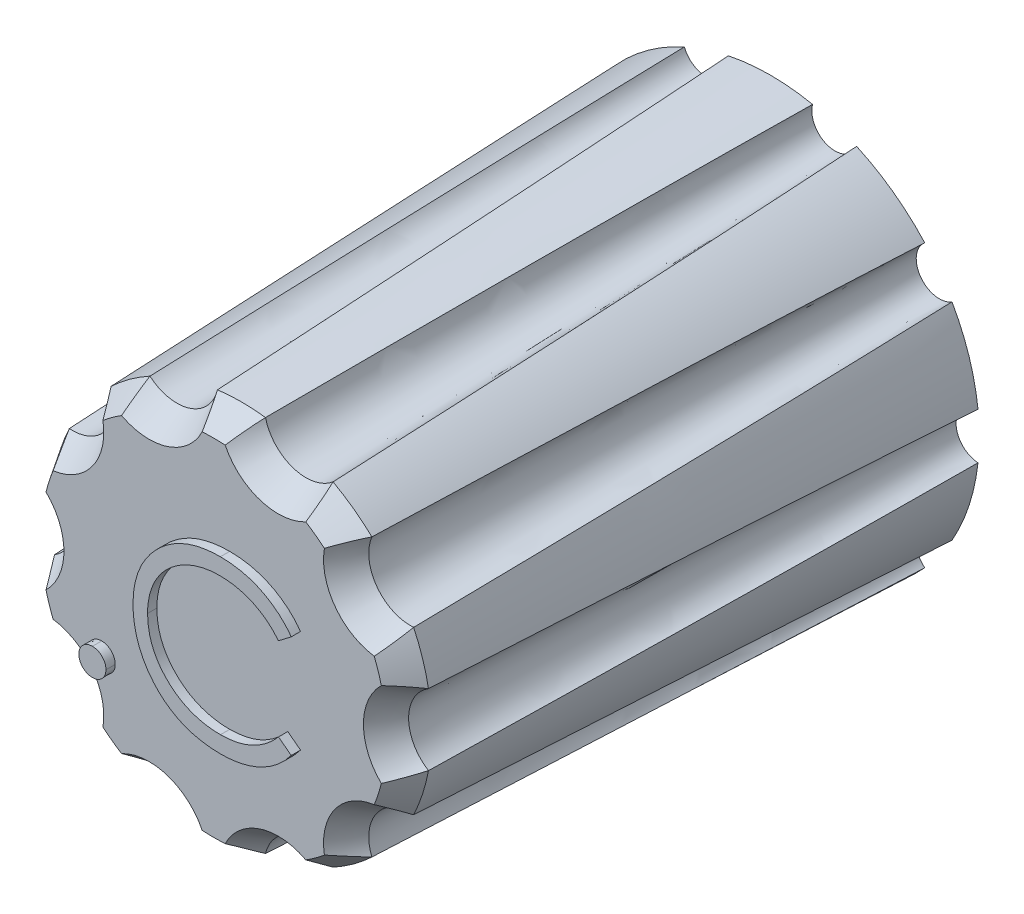
from build123d import *
from OCP.BRepFilletAPI import BRepFilletAPI_MakeChamfer

# Parameters (mm, degrees)
BOSS_EXTRU_1_DEPTH      = 12
BOSS_EXTRU_1_TAPER      = 2
CHANFREIN2_SIZE         = 0.6
CHANFREIN2_SIZE2        = 0.353753521
ENL_V_MAT_EXTRU_1_DEPTH = 10
ESQUISSE4_R             = 0.2
ENL_V_MAT_EXTRU_4_DEPTH = 10
ENL_V_MAT_EXTRU_5_DEPTH = 0.2
BOSS_EXTRU_2_DEPTH      = 0.2
BOSS_EXTRU_2_2_DEPTH    = 0.2
CHANFREIN3_SIZE         = 0.2


with BuildPart() as part:
    # Esquisse1 → Boss.-Extru.1 (new body)
    with BuildSketch(Plane.XY):
        with BuildLine():
            ThreePointArc((4.472222222, -0.499227799), (4, 0), (4.472222222, 0.499227799))
            ThreePointArc((4.472222222, 0.499227799), (4.279754323, 1.390576475), (3.911542518, 2.224822494))
            ThreePointArc((3.911542518, 2.224822494), (3.236067977, 2.351141009), (3.324665043, 3.03259004))
            ThreePointArc((3.324665043, 3.03259004), (2.645033635, 3.640576475), (1.85678652, 4.099066213))
            ThreePointArc((1.85678652, 4.099066213), (1.236067977, 3.804226065), (0.907198818, 4.407605961))
            ThreePointArc((0.907198818, 4.407605961), (0, 4.5), (-0.907198818, 4.407605961))
            ThreePointArc((-0.907198818, 4.407605961), (-1.236067977, 3.804226065), (-1.85678652, 4.099066213))
            ThreePointArc((-1.85678652, 4.099066213), (-2.645033635, 3.640576475), (-3.324665043, 3.03259004))
            ThreePointArc((-3.324665043, 3.03259004), (-3.236067977, 2.351141009), (-3.911542518, 2.224822494))
            ThreePointArc((-3.911542518, 2.224822494), (-4.279754323, 1.390576475), (-4.472222222, 0.499227799))
            ThreePointArc((-4.472222222, 0.499227799), (-4, 0), (-4.472222222, -0.499227799))
            ThreePointArc((-4.472222222, -0.499227799), (-4.279754323, -1.390576475), (-3.911542518, -2.224822494))
            ThreePointArc((-3.911542518, -2.224822494), (-3.236067977, -2.351141009), (-3.324665043, -3.03259004))
            ThreePointArc((-3.324665043, -3.03259004), (-2.645033635, -3.640576475), (-1.85678652, -4.099066213))
            ThreePointArc((-1.85678652, -4.099066213), (-1.236067977, -3.804226065), (-0.907198818, -4.407605961))
            ThreePointArc((-0.907198818, -4.407605961), (0, -4.5), (0.907198818, -4.407605961))
            ThreePointArc((0.907198818, -4.407605961), (1.236067977, -3.804226065), (1.85678652, -4.099066213))
            ThreePointArc((1.85678652, -4.099066213), (2.645033635, -3.640576475), (3.324665043, -3.03259004))
            ThreePointArc((3.324665043, -3.03259004), (3.236067977, -2.351141009), (3.911542518, -2.224822494))
            ThreePointArc((3.911542518, -2.224822494), (4.279754323, -1.390576475), (4.472222222, -0.499227799))
        make_face()
    extrude(amount=BOSS_EXTRU_1_DEPTH, taper=BOSS_EXTRU_1_TAPER)

    # Chanfrein2: one chamfer whose edges measure the first distance from different faces: ONE call of the kernel's chamfer builder (chamfer() names one face for all edges)
    chanfrein2_edges_1 = [part.edges().sort_by_distance(p)[0] for p in [
        (-3.881214819, 1.26108314, 12),
    ]]
    chanfrein2_side_1 = [part.faces().sort_by_distance(p)[0] for p in [
        (-4.080484571, 1.325829807, 6),
    ]]
    chanfrein2_edges_2 = [part.edges().sort_by_distance(p)[0] for p in [
        (-2.897050026, 2.104830049, 12),
    ]]
    chanfrein2_side_2 = [part.faces().sort_by_distance(p)[0] for p in [
        (-3.066559002, 2.227985529, 6),
    ]]
    chanfrein2_edges_3 = [part.edges().sort_by_distance(p)[0] for p in [
        (-2.398722676, 3.301558523, 12),
    ]]
    chanfrein2_side_3 = [part.faces().sort_by_distance(p)[0] for p in [
        (-2.521878155, 3.471067499, 6),
    ]]
    chanfrein2_edges_4 = [part.edges().sort_by_distance(p)[0] for p in [
        (-1.106574643, 3.405686561, 12),
    ]]
    chanfrein2_side_4 = [part.faces().sort_by_distance(p)[0] for p in [
        (-1.17132131, 3.604956313, 6),
    ]]
    chanfrein2_edges_5 = [part.edges().sort_by_distance(p)[0] for p in [
        (0, 4.080950766, 12),
    ]]
    chanfrein2_side_5 = [part.faces().sort_by_distance(p)[0] for p in [
        (0, 4.290475383, 6),
    ]]
    chanfrein2_edges_6 = [part.edges().sort_by_distance(p)[0] for p in [
        (1.106574643, 3.405686561, 12),
    ]]
    chanfrein2_side_6 = [part.faces().sort_by_distance(p)[0] for p in [
        (1.17132131, 3.604956313, 6),
    ]]
    chanfrein2_edges_7 = [part.edges().sort_by_distance(p)[0] for p in [
        (2.398722676, 3.301558523, 12),
    ]]
    chanfrein2_side_7 = [part.faces().sort_by_distance(p)[0] for p in [
        (2.521878155, 3.471067499, 6),
    ]]
    chanfrein2_edges_8 = [part.edges().sort_by_distance(p)[0] for p in [
        (2.897050026, 2.104830049, 12),
    ]]
    chanfrein2_side_8 = [part.faces().sort_by_distance(p)[0] for p in [
        (3.066559002, 2.227985529, 6),
    ]]
    chanfrein2_edges_9 = [part.edges().sort_by_distance(p)[0] for p in [
        (3.881214819, 1.26108314, 12),
    ]]
    chanfrein2_side_9 = [part.faces().sort_by_distance(p)[0] for p in [
        (4.080484571, 1.325829807, 6),
    ]]
    chanfrein2_edges_10 = [part.edges().sort_by_distance(p)[0] for p in [
        (3.580950766, 0, 12),
    ]]
    chanfrein2_side_10 = [part.faces().sort_by_distance(p)[0] for p in [
        (3.790475383, 0, 6),
    ]]
    chanfrein2_edges_11 = [part.edges().sort_by_distance(p)[0] for p in [
        (3.881214819, -1.26108314, 12),
    ]]
    chanfrein2_side_11 = [part.faces().sort_by_distance(p)[0] for p in [
        (4.080484571, -1.325829807, 6),
    ]]
    chanfrein2_edges_12 = [part.edges().sort_by_distance(p)[0] for p in [
        (2.897050026, -2.104830049, 12),
    ]]
    chanfrein2_side_12 = [part.faces().sort_by_distance(p)[0] for p in [
        (3.066559002, -2.227985529, 6),
    ]]
    chanfrein2_edges_13 = [part.edges().sort_by_distance(p)[0] for p in [
        (2.398722676, -3.301558523, 12),
    ]]
    chanfrein2_side_13 = [part.faces().sort_by_distance(p)[0] for p in [
        (2.521878155, -3.471067499, 6),
    ]]
    chanfrein2_edges_14 = [part.edges().sort_by_distance(p)[0] for p in [
        (1.106574643, -3.405686561, 12),
    ]]
    chanfrein2_side_14 = [part.faces().sort_by_distance(p)[0] for p in [
        (1.17132131, -3.604956313, 6),
    ]]
    chanfrein2_edges_15 = [part.edges().sort_by_distance(p)[0] for p in [
        (0, -4.080950766, 12),
    ]]
    chanfrein2_side_15 = [part.faces().sort_by_distance(p)[0] for p in [
        (0, -4.290475383, 6),
    ]]
    chanfrein2_edges_16 = [part.edges().sort_by_distance(p)[0] for p in [
        (-1.106574643, -3.405686561, 12),
    ]]
    chanfrein2_side_16 = [part.faces().sort_by_distance(p)[0] for p in [
        (-1.17132131, -3.604956313, 6),
    ]]
    chanfrein2_edges_17 = [part.edges().sort_by_distance(p)[0] for p in [
        (-2.398722676, -3.301558523, 12),
    ]]
    chanfrein2_side_17 = [part.faces().sort_by_distance(p)[0] for p in [
        (-2.521878155, -3.471067499, 6),
    ]]
    chanfrein2_edges_18 = [part.edges().sort_by_distance(p)[0] for p in [
        (-2.897050026, -2.104830049, 12),
    ]]
    chanfrein2_side_18 = [part.faces().sort_by_distance(p)[0] for p in [
        (-3.066559002, -2.227985529, 6),
    ]]
    chanfrein2_edges_19 = [part.edges().sort_by_distance(p)[0] for p in [
        (-3.881214819, -1.26108314, 12),
    ]]
    chanfrein2_side_19 = [part.faces().sort_by_distance(p)[0] for p in [
        (-4.080484571, -1.325829807, 6),
    ]]
    chanfrein2_edges_20 = [part.edges().sort_by_distance(p)[0] for p in [
        (-3.580950766, 0, 12),
    ]]
    chanfrein2_side_20 = [part.faces().sort_by_distance(p)[0] for p in [
        (-3.790475383, 0, 6),
    ]]
    chanfrein2 = BRepFilletAPI_MakeChamfer(part.part.solid().wrapped)
    for e in chanfrein2_edges_1:
        chanfrein2.Add(CHANFREIN2_SIZE, CHANFREIN2_SIZE2, e.wrapped, chanfrein2_side_1[0].wrapped)  # the first distance lies on this face
    for e in chanfrein2_edges_2:
        chanfrein2.Add(CHANFREIN2_SIZE, CHANFREIN2_SIZE2, e.wrapped, chanfrein2_side_2[0].wrapped)  # the first distance lies on this face
    for e in chanfrein2_edges_3:
        chanfrein2.Add(CHANFREIN2_SIZE, CHANFREIN2_SIZE2, e.wrapped, chanfrein2_side_3[0].wrapped)  # the first distance lies on this face
    for e in chanfrein2_edges_4:
        chanfrein2.Add(CHANFREIN2_SIZE, CHANFREIN2_SIZE2, e.wrapped, chanfrein2_side_4[0].wrapped)  # the first distance lies on this face
    for e in chanfrein2_edges_5:
        chanfrein2.Add(CHANFREIN2_SIZE, CHANFREIN2_SIZE2, e.wrapped, chanfrein2_side_5[0].wrapped)  # the first distance lies on this face
    for e in chanfrein2_edges_6:
        chanfrein2.Add(CHANFREIN2_SIZE, CHANFREIN2_SIZE2, e.wrapped, chanfrein2_side_6[0].wrapped)  # the first distance lies on this face
    for e in chanfrein2_edges_7:
        chanfrein2.Add(CHANFREIN2_SIZE, CHANFREIN2_SIZE2, e.wrapped, chanfrein2_side_7[0].wrapped)  # the first distance lies on this face
    for e in chanfrein2_edges_8:
        chanfrein2.Add(CHANFREIN2_SIZE, CHANFREIN2_SIZE2, e.wrapped, chanfrein2_side_8[0].wrapped)  # the first distance lies on this face
    for e in chanfrein2_edges_9:
        chanfrein2.Add(CHANFREIN2_SIZE, CHANFREIN2_SIZE2, e.wrapped, chanfrein2_side_9[0].wrapped)  # the first distance lies on this face
    for e in chanfrein2_edges_10:
        chanfrein2.Add(CHANFREIN2_SIZE, CHANFREIN2_SIZE2, e.wrapped, chanfrein2_side_10[0].wrapped)  # the first distance lies on this face
    for e in chanfrein2_edges_11:
        chanfrein2.Add(CHANFREIN2_SIZE, CHANFREIN2_SIZE2, e.wrapped, chanfrein2_side_11[0].wrapped)  # the first distance lies on this face
    for e in chanfrein2_edges_12:
        chanfrein2.Add(CHANFREIN2_SIZE, CHANFREIN2_SIZE2, e.wrapped, chanfrein2_side_12[0].wrapped)  # the first distance lies on this face
    for e in chanfrein2_edges_13:
        chanfrein2.Add(CHANFREIN2_SIZE, CHANFREIN2_SIZE2, e.wrapped, chanfrein2_side_13[0].wrapped)  # the first distance lies on this face
    for e in chanfrein2_edges_14:
        chanfrein2.Add(CHANFREIN2_SIZE, CHANFREIN2_SIZE2, e.wrapped, chanfrein2_side_14[0].wrapped)  # the first distance lies on this face
    for e in chanfrein2_edges_15:
        chanfrein2.Add(CHANFREIN2_SIZE, CHANFREIN2_SIZE2, e.wrapped, chanfrein2_side_15[0].wrapped)  # the first distance lies on this face
    for e in chanfrein2_edges_16:
        chanfrein2.Add(CHANFREIN2_SIZE, CHANFREIN2_SIZE2, e.wrapped, chanfrein2_side_16[0].wrapped)  # the first distance lies on this face
    for e in chanfrein2_edges_17:
        chanfrein2.Add(CHANFREIN2_SIZE, CHANFREIN2_SIZE2, e.wrapped, chanfrein2_side_17[0].wrapped)  # the first distance lies on this face
    for e in chanfrein2_edges_18:
        chanfrein2.Add(CHANFREIN2_SIZE, CHANFREIN2_SIZE2, e.wrapped, chanfrein2_side_18[0].wrapped)  # the first distance lies on this face
    for e in chanfrein2_edges_19:
        chanfrein2.Add(CHANFREIN2_SIZE, CHANFREIN2_SIZE2, e.wrapped, chanfrein2_side_19[0].wrapped)  # the first distance lies on this face
    for e in chanfrein2_edges_20:
        chanfrein2.Add(CHANFREIN2_SIZE, CHANFREIN2_SIZE2, e.wrapped, chanfrein2_side_20[0].wrapped)  # the first distance lies on this face
    add(Compound.cast(chanfrein2.Shape()), mode=Mode.REPLACE)

    # Esquisse2 → Enlèv. mat.-Extru.1 (cut)
    with BuildSketch(Plane(origin=(0, 0, 0), x_dir=(-1, 0, 0), z_dir=(0, 0, -1))):
        with BuildLine():
            Line((-2.655183609, -1.6), (2.655183609, -1.6))
            ThreePointArc((2.655183609, -1.6), (2.986726401, -0.830340536), (3.1, 0))
            ThreePointArc((3.1, 0), (-0.830340536, 2.986726401), (-2.655183609, -1.6))
        make_face()
    extrude(amount=-ENL_V_MAT_EXTRU_1_DEPTH, mode=Mode.SUBTRACT)

    # Esquisse4 → Enlèv. mat.-Extru.4 (cut)
    with BuildSketch(Plane(origin=(0, 0, 0), x_dir=(-1, 0, 0), z_dir=(0, 0, -1))):
        with Locations((-2.655183609, -1.6)):
            Circle(ESQUISSE4_R)
        with Locations((2.598076211, -1.6)):
            Circle(ESQUISSE4_R)
    extrude(amount=-ENL_V_MAT_EXTRU_4_DEPTH, mode=Mode.SUBTRACT)

    # Esquisse5 → Enlèv. mat.-Extru.5 (cut)
    with BuildSketch(Plane.XY.offset(12)):
        with BuildLine():
            add(Edge.make_bspline(
                [(-2.413360869, -1.266888341), (-2.393870657, -1.268046507), (-2.355662375, -1.270316958), (-2.300423246, -1.285893631), (-2.250428587, -1.313552292), (-2.205896342, -1.35041507), (-2.169189865, -1.395110733), (-2.140545513, -1.444706642), (-2.125104528, -1.500408235), (-2.122850616, -1.53883791), (-2.121694203, -1.558555007)],
                knots=[0, 0, 0, 0, 1.020151414, 1.999887582, 2.974338812, 3.990962822, 5.007586832, 5.987933904, 6.967670073, 8, 8, 8, 8], degree=3))
            add(Edge.make_bspline(
                [(-2.121694203, -1.558555007), (-2.122889803, -1.577798337), (-2.125247511, -1.615745901), (-2.140510119, -1.671027363), (-2.169408169, -1.720654268), (-2.205643162, -1.765956406), (-2.250439595, -1.802897276), (-2.300541442, -1.830320621), (-2.3555327, -1.847012601), (-2.393849023, -1.849138898), (-2.413360869, -1.850221674)],
                knots=[0, 0, 0, 0, 1.009421747, 1.99056486, 2.972319754, 3.999869655, 5.017953583, 5.993804169, 6.978383603, 8, 8, 8, 8], degree=3))
            add(Edge.make_bspline(
                [(-2.413360869, -1.850221674), (-2.432886775, -1.849178077), (-2.471006458, -1.847140702), (-2.525792452, -1.829977895), (-2.57619942, -1.803154435), (-2.620987132, -1.765887526), (-2.657525604, -1.720887382), (-2.685150987, -1.670685586), (-2.701741136, -1.615904148), (-2.703923008, -1.577829506), (-2.705027536, -1.558555007)],
                knots=[0, 0, 0, 0, 1.022052826, 1.995314843, 2.982371812, 4.00089066, 5.028879526, 6.005146991, 6.990147033, 8, 8, 8, 8], degree=3))
            add(Edge.make_bspline(
                [(-2.705027536, -1.558555007), (-2.703965437, -1.538805628), (-2.701891818, -1.500247388), (-2.685116158, -1.44504828), (-2.657739946, -1.394879841), (-2.620734551, -1.350483261), (-2.576210255, -1.313295958), (-2.52591405, -1.286231165), (-2.47087451, -1.270190753), (-2.432864571, -1.268008236), (-2.413360869, -1.266888341)],
                knots=[0, 0, 0, 0, 1.032775665, 2.016367738, 2.991239715, 4.008302682, 5.025365648, 6.011011707, 6.979408107, 8, 8, 8, 8], degree=3))
        make_face()
        with BuildLine():
            Line((1.871895541, 1.052422557), (1.597055797, 0.842086018))
            add(Edge.make_bspline(
                [(1.597055797, 0.842086018), (1.577449909, 0.865451988), (1.538502462, 0.911868904), (1.47584326, 0.977048448), (1.410541617, 1.03811371), (1.342622495, 1.09535559), (1.270863376, 1.146772355), (1.197002577, 1.195043458), (1.119804532, 1.238311196), (1.013052797, 1.290774182), (0.873404949, 1.345520337), (0.69761011, 1.391423569), (0.514099012, 1.420644744), (0.388901412, 1.423809586), (0.325220861, 1.425419352)],
                knots=[0, 0, 0, 0, 0.757959112, 1.505699292, 2.245454638, 2.979532153, 3.711538275, 4.438200793, 5.171680507, 5.909471876, 7.393775596, 8.890124382, 10.418191784, 12, 12, 12, 12], degree=3))
            add(Edge.make_bspline(
                [(0.325220861, 1.425419352), (0.290137562, 1.425015389), (0.220296569, 1.424211213), (0.116648096, 1.413602088), (0.014935045, 1.398690878), (-0.084776421, 1.376565555), (-0.18235938, 1.348592936), (-0.278451782, 1.315167522), (-0.371662382, 1.273812682), (-0.46328062, 1.228104422), (-0.551059831, 1.176476977), (-0.634114879, 1.120163626), (-0.712142847, 1.059794529), (-0.785205459, 0.995143423), (-0.853377407, 0.926501462), (-0.916164718, 0.853137121), (-0.973350128, 0.775284947), (-1.026067153, 0.69397154), (-1.073279887, 0.609433748), (-1.112809766, 0.521358677), (-1.147814888, 0.431254574), (-1.175514131, 0.338103414), (-1.197438648, 0.242560648), (-1.212566311, 0.14436986), (-1.223054782, 0.04373618), (-1.223854959, -0.024473132), (-1.224258305, -0.058855488)],
                knots=[0, 0, 0, 0, 1.054917814, 2.100044995, 3.131103042, 4.146048494, 5.169673617, 6.183595914, 7.203665975, 8.234915748, 9.262203917, 10.264457458, 11.251630812, 12.227803204, 13.197192746, 14.159520551, 15.12972552, 16.100847026, 17.073214652, 18.039054194, 19.002613845, 19.979014051, 20.95965708, 21.949030935, 22.966165397, 24, 24, 24, 24], degree=3))
            add(Edge.make_bspline(
                [(-1.224258305, -0.058855488), (-1.222996486, -0.110586808), (-1.220519072, -0.212154393), (-1.198470738, -0.360925003), (-1.164965647, -0.503445677), (-1.11475007, -0.638825519), (-1.052831019, -0.768733877), (-0.974590408, -0.890972731), (-0.88397387, -1.007389295), (-0.779699451, -1.115232243), (-0.665293635, -1.213745968), (-0.542545723, -1.30049655), (-0.411761435, -1.372811432), (-0.274384805, -1.432987379), (-0.129358691, -1.479244107), (0.023056111, -1.51180823), (0.182528106, -1.533050411), (0.291497506, -1.535084099), (0.346955637, -1.53611911)],
                knots=[0, 0, 0, 0, 1.029171465, 2.020641659, 2.987623507, 3.938342917, 4.889210282, 5.84687017, 6.821220943, 7.821438502, 8.827599549, 9.822697543, 10.807740252, 11.797342354, 12.80366471, 13.83203677, 14.896651826, 16, 16, 16, 16], degree=3))
            add(Edge.make_bspline(
                [(0.346955637, -1.53611911), (0.408058326, -1.53443033), (0.528323035, -1.531106407), (0.704691061, -1.502947158), (0.873526827, -1.45728924), (1.034839413, -1.393391318), (1.18817406, -1.31032603), (1.33377072, -1.209628153), (1.47175229, -1.09033982), (1.554723573, -0.999256692), (1.597055797, -0.952785776)],
                knots=[0, 0, 0, 0, 1.028121516, 2.023589091, 2.998037872, 3.967518031, 4.937445131, 5.927275754, 6.942489185, 8, 8, 8, 8], degree=3))
            Line((1.597055797, -0.952785776), (1.871895541, -1.161018949))
            add(Edge.make_bspline(
                [(1.871895541, -1.161018949), (1.849777431, -1.189557401), (1.805647156, -1.246497608), (1.734189139, -1.326769317), (1.658911841, -1.402273353), (1.579256131, -1.472400974), (1.49613834, -1.53855544), (1.408066027, -1.598857271), (1.316196995, -1.654148155), (1.220842516, -1.70477508), (1.122103903, -1.749692327), (1.020099468, -1.788146095), (0.915268893, -1.821270984), (0.807607384, -1.848522921), (0.696891628, -1.869794005), (0.583521153, -1.88401368), (0.467251278, -1.893755594), (0.388809857, -1.89464351), (0.349059002, -1.895093469)],
                knots=[0, 0, 0, 0, 0.986787822, 1.968848986, 2.935600012, 3.899624008, 4.868462664, 5.837806735, 6.815139263, 7.798259679, 8.787526145, 9.778297419, 10.776456485, 11.791383307, 12.812564526, 13.85620153, 14.913611965, 16, 16, 16, 16], degree=3))
            add(Edge.make_bspline(
                [(0.349059002, -1.895093469), (0.311415335, -1.894831476), (0.236979645, -1.894313418), (0.127080894, -1.885921251), (0.020091313, -1.874471514), (-0.083683313, -1.857231383), (-0.184809288, -1.836887043), (-0.282369873, -1.809615786), (-0.377325083, -1.77906662), (-0.469293424, -1.743161633), (-0.558353123, -1.70264545), (-0.644216935, -1.656853891), (-0.726845367, -1.606172027), (-0.807050788, -1.551717016), (-0.883648372, -1.491739715), (-0.957301897, -1.42707308), (-1.028424373, -1.357935069), (-1.072427058, -1.308080216), (-1.094550773, -1.283014142)],
                knots=[0, 0, 0, 0, 1.114604814, 2.203992996, 3.262667896, 4.300477797, 5.318619304, 6.316056647, 7.298880507, 8.271930387, 9.238335007, 10.195173496, 11.151986948, 12.108099108, 13.064862484, 14.031167946, 15.010108607, 16, 16, 16, 16], degree=3))
            add(Edge.make_bspline(
                [(-1.094550773, -1.283014142), (-1.129986417, -1.239472953), (-1.200429894, -1.152916242), (-1.290555577, -1.012630261), (-1.367703132, -0.866162052), (-1.430079053, -0.712742124), (-1.478841786, -0.552714736), (-1.512622981, -0.385999222), (-1.534574586, -0.21275128), (-1.537084875, -0.094914491), (-1.538360869, -0.035017347)],
                knots=[0, 0, 0, 0, 0.994628077, 1.977248131, 2.950237994, 3.925870899, 4.908910175, 5.911660606, 6.938484602, 8, 8, 8, 8], degree=3))
            add(Edge.make_bspline(
                [(-1.538360869, -0.035017347), (-1.536805676, 0.027938107), (-1.53374593, 0.151799031), (-1.507750134, 0.333572984), (-1.465931338, 0.507724383), (-1.406534449, 0.673928128), (-1.331229098, 0.833058408), (-1.238202484, 0.983899613), (-1.128535342, 1.127416413), (-1.003087774, 1.261431164), (-0.865520439, 1.383970517), (-0.718201625, 1.49177672), (-0.561419678, 1.581494236), (-0.396901826, 1.656490399), (-0.223416145, 1.714134862), (-0.041332776, 1.754488049), (0.149006139, 1.779605165), (0.278868565, 1.782780373), (0.344852272, 1.784393711)],
                knots=[0, 0, 0, 0, 1.032925535, 2.032216505, 3.007276963, 3.968222605, 4.92396291, 5.891752235, 6.871517503, 7.883894988, 8.900124299, 9.891468569, 10.874487609, 11.85992873, 12.854644235, 13.869047385, 14.917252991, 16, 16, 16, 16], degree=3))
            add(Edge.make_bspline(
                [(0.344852272, 1.784393711), (0.385066744, 1.783911573), (0.464667241, 1.782957229), (0.582419893, 1.773651086), (0.69706222, 1.75813748), (0.808673202, 1.73702141), (0.917795818, 1.710814089), (1.023596059, 1.676673791), (1.126694746, 1.637637259), (1.226441654, 1.592678793), (1.322358205, 1.542212052), (1.414414523, 1.486796428), (1.501879382, 1.426500623), (1.58536823, 1.361837448), (1.663484441, 1.291438888), (1.73844592, 1.217241292), (1.807706998, 1.137107468), (1.850460193, 1.080702534), (1.871895541, 1.052422557)],
                knots=[0, 0, 0, 0, 1.096760587, 2.17092713, 3.219439832, 4.250915756, 5.268269357, 6.278326846, 7.281116186, 8.274029601, 9.260640565, 10.235837813, 11.203064059, 12.156899882, 13.114053108, 14.069676657, 15.032185724, 16, 16, 16, 16], degree=3))
        make_face()
    extrude(amount=-ENL_V_MAT_EXTRU_5_DEPTH, mode=Mode.SUBTRACT)

    # Chanfrein3
    chanfrein3_edges = [part.edges().sort_by_distance(p)[0] for p in [
        (0.028553699, -1.6, 0),
    ]]
    chamfer(chanfrein3_edges, length=CHANFREIN3_SIZE - 0.0001)  # a hair under: the kernel refuses the full size


with BuildPart() as body_2:
    # Esquisse5<2> → Boss.-Extru.2 (new body)
    with BuildSketch(Plane.XY.offset(12)):
        with BuildLine():
            add(Edge.make_bspline(
                [(-2.413360869, -1.266888341), (-2.393870657, -1.268046507), (-2.355662375, -1.270316958), (-2.300423246, -1.285893631), (-2.250428587, -1.313552292), (-2.205896342, -1.35041507), (-2.169189865, -1.395110733), (-2.140545513, -1.444706642), (-2.125104528, -1.500408235), (-2.122850616, -1.53883791), (-2.121694203, -1.558555007)],
                knots=[0, 0, 0, 0, 1.020151414, 1.999887582, 2.974338812, 3.990962822, 5.007586832, 5.987933904, 6.967670073, 8, 8, 8, 8], degree=3))
            add(Edge.make_bspline(
                [(-2.121694203, -1.558555007), (-2.122889803, -1.577798337), (-2.125247511, -1.615745901), (-2.140510119, -1.671027363), (-2.169408169, -1.720654268), (-2.205643162, -1.765956406), (-2.250439595, -1.802897276), (-2.300541442, -1.830320621), (-2.3555327, -1.847012601), (-2.393849023, -1.849138898), (-2.413360869, -1.850221674)],
                knots=[0, 0, 0, 0, 1.009421747, 1.99056486, 2.972319754, 3.999869655, 5.017953583, 5.993804169, 6.978383603, 8, 8, 8, 8], degree=3))
            add(Edge.make_bspline(
                [(-2.413360869, -1.850221674), (-2.432886775, -1.849178077), (-2.471006458, -1.847140702), (-2.525792452, -1.829977895), (-2.57619942, -1.803154435), (-2.620987132, -1.765887526), (-2.657525604, -1.720887382), (-2.685150987, -1.670685586), (-2.701741136, -1.615904148), (-2.703923008, -1.577829506), (-2.705027536, -1.558555007)],
                knots=[0, 0, 0, 0, 1.022052826, 1.995314843, 2.982371812, 4.00089066, 5.028879526, 6.005146991, 6.990147033, 8, 8, 8, 8], degree=3))
            add(Edge.make_bspline(
                [(-2.705027536, -1.558555007), (-2.703965437, -1.538805628), (-2.701891818, -1.500247388), (-2.685116158, -1.44504828), (-2.657739946, -1.394879841), (-2.620734551, -1.350483261), (-2.576210255, -1.313295958), (-2.52591405, -1.286231165), (-2.47087451, -1.270190753), (-2.432864571, -1.268008236), (-2.413360869, -1.266888341)],
                knots=[0, 0, 0, 0, 1.032775665, 2.016367738, 2.991239715, 4.008302682, 5.025365648, 6.011011707, 6.979408107, 8, 8, 8, 8], degree=3))
        make_face()
    extrude(amount=BOSS_EXTRU_2_DEPTH)


with BuildPart() as body_3:
    # Esquisse5<2> → Boss.-Extru.2 2 (new body)
    with BuildSketch(Plane.XY.offset(12)):
        with BuildLine():
            Line((1.871895541, 1.052422557), (1.597055797, 0.842086018))
            add(Edge.make_bspline(
                [(1.597055797, 0.842086018), (1.577449909, 0.865451988), (1.538502462, 0.911868904), (1.47584326, 0.977048448), (1.410541617, 1.03811371), (1.342622495, 1.09535559), (1.270863376, 1.146772355), (1.197002577, 1.195043458), (1.119804532, 1.238311196), (1.013052797, 1.290774182), (0.873404949, 1.345520337), (0.69761011, 1.391423569), (0.514099012, 1.420644744), (0.388901412, 1.423809586), (0.325220861, 1.425419352)],
                knots=[0, 0, 0, 0, 0.757959112, 1.505699292, 2.245454638, 2.979532153, 3.711538275, 4.438200793, 5.171680507, 5.909471876, 7.393775596, 8.890124382, 10.418191784, 12, 12, 12, 12], degree=3))
            add(Edge.make_bspline(
                [(0.325220861, 1.425419352), (0.290137562, 1.425015389), (0.220296569, 1.424211213), (0.116648096, 1.413602088), (0.014935045, 1.398690878), (-0.084776421, 1.376565555), (-0.18235938, 1.348592936), (-0.278451782, 1.315167522), (-0.371662382, 1.273812682), (-0.46328062, 1.228104422), (-0.551059831, 1.176476977), (-0.634114879, 1.120163626), (-0.712142847, 1.059794529), (-0.785205459, 0.995143423), (-0.853377407, 0.926501462), (-0.916164718, 0.853137121), (-0.973350128, 0.775284947), (-1.026067153, 0.69397154), (-1.073279887, 0.609433748), (-1.112809766, 0.521358677), (-1.147814888, 0.431254574), (-1.175514131, 0.338103414), (-1.197438648, 0.242560648), (-1.212566311, 0.14436986), (-1.223054782, 0.04373618), (-1.223854959, -0.024473132), (-1.224258305, -0.058855488)],
                knots=[0, 0, 0, 0, 1.054917814, 2.100044995, 3.131103042, 4.146048494, 5.169673617, 6.183595914, 7.203665975, 8.234915748, 9.262203917, 10.264457458, 11.251630812, 12.227803204, 13.197192746, 14.159520551, 15.12972552, 16.100847026, 17.073214652, 18.039054194, 19.002613845, 19.979014051, 20.95965708, 21.949030935, 22.966165397, 24, 24, 24, 24], degree=3))
            add(Edge.make_bspline(
                [(-1.224258305, -0.058855488), (-1.222996486, -0.110586808), (-1.220519072, -0.212154393), (-1.198470738, -0.360925003), (-1.164965647, -0.503445677), (-1.11475007, -0.638825519), (-1.052831019, -0.768733877), (-0.974590408, -0.890972731), (-0.88397387, -1.007389295), (-0.779699451, -1.115232243), (-0.665293635, -1.213745968), (-0.542545723, -1.30049655), (-0.411761435, -1.372811432), (-0.274384805, -1.432987379), (-0.129358691, -1.479244107), (0.023056111, -1.51180823), (0.182528106, -1.533050411), (0.291497506, -1.535084099), (0.346955637, -1.53611911)],
                knots=[0, 0, 0, 0, 1.029171465, 2.020641659, 2.987623507, 3.938342917, 4.889210282, 5.84687017, 6.821220943, 7.821438502, 8.827599549, 9.822697543, 10.807740252, 11.797342354, 12.80366471, 13.83203677, 14.896651826, 16, 16, 16, 16], degree=3))
            add(Edge.make_bspline(
                [(0.346955637, -1.53611911), (0.408058326, -1.53443033), (0.528323035, -1.531106407), (0.704691061, -1.502947158), (0.873526827, -1.45728924), (1.034839413, -1.393391318), (1.18817406, -1.31032603), (1.33377072, -1.209628153), (1.47175229, -1.09033982), (1.554723573, -0.999256692), (1.597055797, -0.952785776)],
                knots=[0, 0, 0, 0, 1.028121516, 2.023589091, 2.998037872, 3.967518031, 4.937445131, 5.927275754, 6.942489185, 8, 8, 8, 8], degree=3))
            Line((1.597055797, -0.952785776), (1.871895541, -1.161018949))
            add(Edge.make_bspline(
                [(1.871895541, -1.161018949), (1.849777431, -1.189557401), (1.805647156, -1.246497608), (1.734189139, -1.326769317), (1.658911841, -1.402273353), (1.579256131, -1.472400974), (1.49613834, -1.53855544), (1.408066027, -1.598857271), (1.316196995, -1.654148155), (1.220842516, -1.70477508), (1.122103903, -1.749692327), (1.020099468, -1.788146095), (0.915268893, -1.821270984), (0.807607384, -1.848522921), (0.696891628, -1.869794005), (0.583521153, -1.88401368), (0.467251278, -1.893755594), (0.388809857, -1.89464351), (0.349059002, -1.895093469)],
                knots=[0, 0, 0, 0, 0.986787822, 1.968848986, 2.935600012, 3.899624008, 4.868462664, 5.837806735, 6.815139263, 7.798259679, 8.787526145, 9.778297419, 10.776456485, 11.791383307, 12.812564526, 13.85620153, 14.913611965, 16, 16, 16, 16], degree=3))
            add(Edge.make_bspline(
                [(0.349059002, -1.895093469), (0.311415335, -1.894831476), (0.236979645, -1.894313418), (0.127080894, -1.885921251), (0.020091313, -1.874471514), (-0.083683313, -1.857231383), (-0.184809288, -1.836887043), (-0.282369873, -1.809615786), (-0.377325083, -1.77906662), (-0.469293424, -1.743161633), (-0.558353123, -1.70264545), (-0.644216935, -1.656853891), (-0.726845367, -1.606172027), (-0.807050788, -1.551717016), (-0.883648372, -1.491739715), (-0.957301897, -1.42707308), (-1.028424373, -1.357935069), (-1.072427058, -1.308080216), (-1.094550773, -1.283014142)],
                knots=[0, 0, 0, 0, 1.114604814, 2.203992996, 3.262667896, 4.300477797, 5.318619304, 6.316056647, 7.298880507, 8.271930387, 9.238335007, 10.195173496, 11.151986948, 12.108099108, 13.064862484, 14.031167946, 15.010108607, 16, 16, 16, 16], degree=3))
            add(Edge.make_bspline(
                [(-1.094550773, -1.283014142), (-1.129986417, -1.239472953), (-1.200429894, -1.152916242), (-1.290555577, -1.012630261), (-1.367703132, -0.866162052), (-1.430079053, -0.712742124), (-1.478841786, -0.552714736), (-1.512622981, -0.385999222), (-1.534574586, -0.21275128), (-1.537084875, -0.094914491), (-1.538360869, -0.035017347)],
                knots=[0, 0, 0, 0, 0.994628077, 1.977248131, 2.950237994, 3.925870899, 4.908910175, 5.911660606, 6.938484602, 8, 8, 8, 8], degree=3))
            add(Edge.make_bspline(
                [(-1.538360869, -0.035017347), (-1.536805676, 0.027938107), (-1.53374593, 0.151799031), (-1.507750134, 0.333572984), (-1.465931338, 0.507724383), (-1.406534449, 0.673928128), (-1.331229098, 0.833058408), (-1.238202484, 0.983899613), (-1.128535342, 1.127416413), (-1.003087774, 1.261431164), (-0.865520439, 1.383970517), (-0.718201625, 1.49177672), (-0.561419678, 1.581494236), (-0.396901826, 1.656490399), (-0.223416145, 1.714134862), (-0.041332776, 1.754488049), (0.149006139, 1.779605165), (0.278868565, 1.782780373), (0.344852272, 1.784393711)],
                knots=[0, 0, 0, 0, 1.032925535, 2.032216505, 3.007276963, 3.968222605, 4.92396291, 5.891752235, 6.871517503, 7.883894988, 8.900124299, 9.891468569, 10.874487609, 11.85992873, 12.854644235, 13.869047385, 14.917252991, 16, 16, 16, 16], degree=3))
            add(Edge.make_bspline(
                [(0.344852272, 1.784393711), (0.385066744, 1.783911573), (0.464667241, 1.782957229), (0.582419893, 1.773651086), (0.69706222, 1.75813748), (0.808673202, 1.73702141), (0.917795818, 1.710814089), (1.023596059, 1.676673791), (1.126694746, 1.637637259), (1.226441654, 1.592678793), (1.322358205, 1.542212052), (1.414414523, 1.486796428), (1.501879382, 1.426500623), (1.58536823, 1.361837448), (1.663484441, 1.291438888), (1.73844592, 1.217241292), (1.807706998, 1.137107468), (1.850460193, 1.080702534), (1.871895541, 1.052422557)],
                knots=[0, 0, 0, 0, 1.096760587, 2.17092713, 3.219439832, 4.250915756, 5.268269357, 6.278326846, 7.281116186, 8.274029601, 9.260640565, 10.235837813, 11.203064059, 12.156899882, 13.114053108, 14.069676657, 15.032185724, 16, 16, 16, 16], degree=3))
        make_face()
    extrude(amount=BOSS_EXTRU_2_2_DEPTH)


solid = Compound([part.part, body_2.part, body_3.part])
